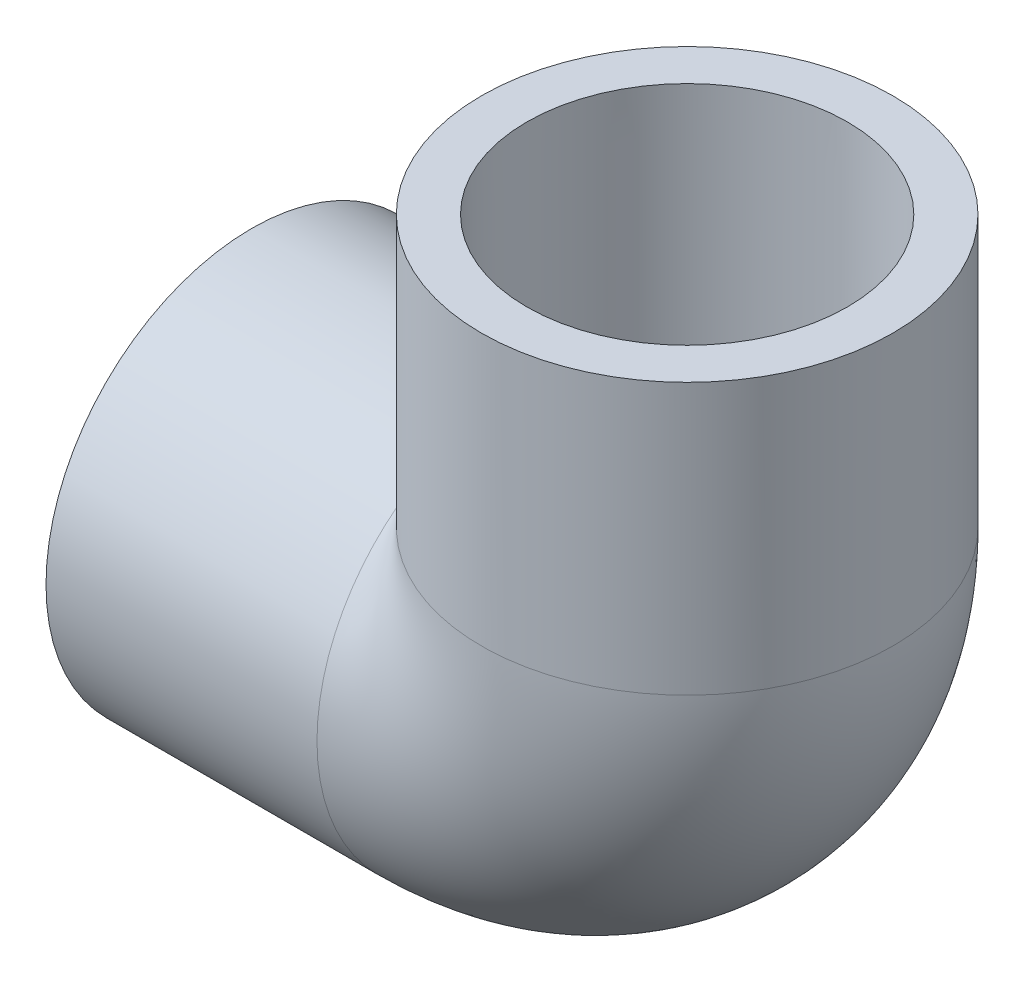
from build123d import *

# Parameters (mm, degrees)
SKETCH3_R   = 21.59
SKETCH3_R_2 = 12.1539


with BuildPart() as part:
    # Sketch1 → Revolve1 (revolve)
    with BuildSketch(Plane.XY, mode=Mode.PRIVATE) as revolve1_sk:
        Polygon((-45.72, -21.59), (-17.272, -21.59), (-17.272, -16.637), (-45.72, -16.8275), align=None)
    revolve(revolve1_sk.sketch.rotate(Axis((-45.72, 0, 0), (1, 0, 0)), 270), axis=Axis((-45.72, 0, 0), (1, 0, 0)))


with BuildPart() as body_2:
    # Sketch2 → Revolve2 (revolve)
    with BuildSketch(Plane.XY, mode=Mode.PRIVATE) as revolve2_sk:
        Polygon((16.8275, 45.72), (16.637, 17.272), (21.59, 17.272), (21.59, 45.72), align=None)
    revolve(revolve2_sk.sketch.rotate(Axis((0, 0, 0), (0, 1, 0)), 90), axis=Axis((0, 0, 0), (0, 1, 0)))


with BuildPart() as sweep1_tool:
    # Sweep1: sweep along a path in Sketch4
    with BuildLine(Plane.XY) as sweep1_path:
        ThreePointArc((-17.272, 0), (-5.058852, 5.058852), (0, 17.272))
    # Sketch3 → Sweep1 (sweep)
    with BuildSketch(Plane(origin=(-17.272, 0, 0), x_dir=(0, 0, -1), z_dir=(1, 0, 0))):
        Circle(SKETCH3_R)
        Circle(SKETCH3_R_2, mode=Mode.SUBTRACT)
    sweep(path=sweep1_path.line)


with BuildPart() as part_1:
    add(part.part)


with BuildPart() as part_2:
    # Sweep1: joined with sweep1_tool
    add(part_1.part.fuse(sweep1_tool.part, body_2.part, tol=0.00001))


solid = part_2.part
